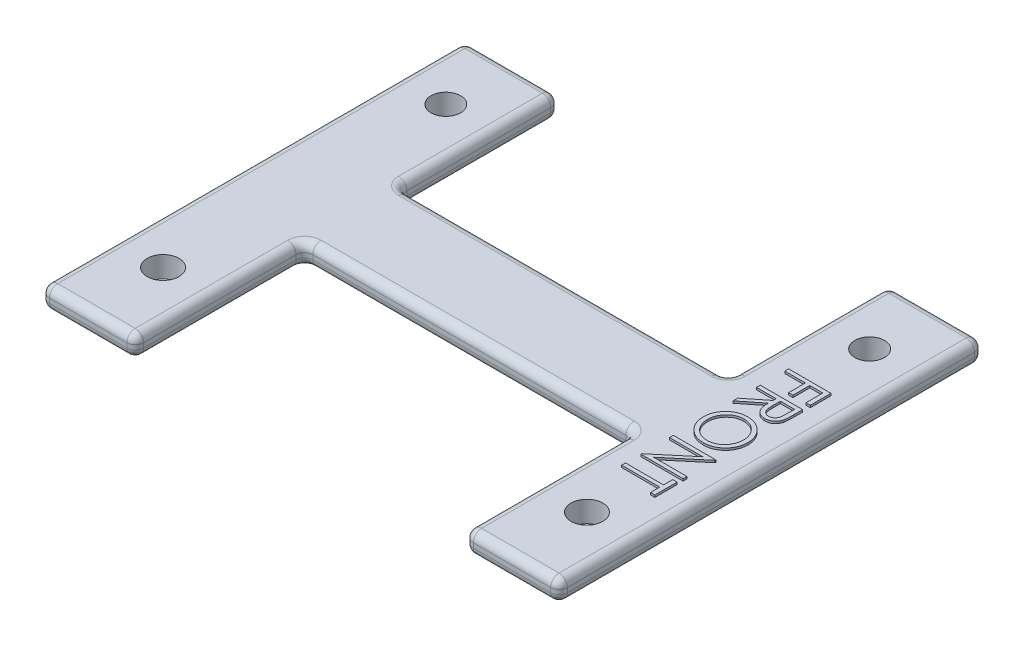
from build123d import *

# Parameters (mm, degrees)
BOSS_EXTRUDE4_DEPTH = 12.7
FILLET1_R           = 10
FILLET2_R           = 10
FILLET3_R           = 10
FILLET4_R           = 10
SKETCH2_R           = 17.78
SKETCH2_R_2         = 19.05
CUT_EXTRUDE1_DEPTH  = 45.72
BOSS_EXTRUDE5_DEPTH = 2.54


with BuildPart() as part:
    # Sketch1 → Boss-Extrude4 (new, symmetric)
    with BuildSketch(Plane(origin=(0, 0, 0), x_dir=(1, 0, 0), z_dir=(0, 1, 0))):
        Polygon((-310.388, 248.768026359), (-197.612, 248.768026359), (-197.612, 79.350026359), (-197.612, 56.388), (197.612, 56.388), (197.612, 79.350026359), (197.612, 248.768026359), (310.388, 248.768026359), (310.388, -259.231973641), (197.612, -259.231973641), (197.612, -89.813973641), (197.612, -56.388), (-197.612, -56.388), (-197.612, -89.813973641), (-197.612, -259.231973641), (-310.388, -259.231973641), align=None)
    extrude(amount=BOSS_EXTRUDE4_DEPTH, both=True)

    # Fillet1
    fillet1_edges = [part.edges().sort_by_distance(p)[0] for p in [
        (197.612, 12.7, 157.809986821),
        (0, 12.7, 56.388),
        (-197.612, 12.7, 157.809986821),
        (197.612, 0, 56.388),
        (-197.612, 0, 56.388),
        (-197.612, 0, 259.231973641),
        (-197.612, -12.7, 157.809986821),
        (0, -12.7, 56.388),
        (197.612, -12.7, 157.809986821),
    ]]
    fillet(fillet1_edges, radius=FILLET1_R)

    # Fillet2
    # the kernel refuses this fillet: 10 mm, written as the material it takes off along each edge
    with BuildSketch(Plane(origin=(-207.612, 2.7, 249.231973641), x_dir=(0, 0, 1), z_dir=(0, 1, 0))) as fillet2_piece_1_section:
        Polygon((0, 0), (FILLET2_R, 0), (FILLET2_R, FILLET2_R), (0, FILLET2_R), align=None)
    fillet2_piece_1 = extrude(amount=FILLET2_R, mode=Mode.PRIVATE)
    fillet2_piece_1 = fillet2_piece_1 - Plane(origin=(-207.612, 2.7, 249.231973641), x_dir=(-0.7071067811865475, 0, -0.7071067811865475), z_dir=(0, 1, 0)) * Sphere(FILLET2_R, mode=Mode.PRIVATE)
    add(fillet2_piece_1, mode=Mode.SUBTRACT)
    with BuildSketch(Plane(origin=(-207.612, -2.7, 249.231973641), x_dir=(0, -1, 0), z_dir=(0, 0, 1))) as fillet2_piece_2_section:
        Polygon((0, 0), (FILLET2_R, 0), (FILLET2_R, FILLET2_R), (0, FILLET2_R), align=None)
    fillet2_piece_2 = extrude(amount=FILLET2_R, mode=Mode.PRIVATE)
    fillet2_piece_2 = fillet2_piece_2 - Plane(origin=(-207.612, -2.7, 249.231973641), x_dir=(-0.7071067811865475, 0.7071067811865475, 0), z_dir=(0, 0, 1)) * Sphere(FILLET2_R, mode=Mode.PRIVATE)
    add(fillet2_piece_2, mode=Mode.SUBTRACT)
    with BuildSketch(Plane(origin=(-207.612, 12.7, 259.231973641), x_dir=(0, 0, -1), z_dir=(-1, 0, 0)), Plane(origin=(-207.612, -12.7, 259.231973641), x_dir=(0, 1, 0), z_dir=(-1, 0, 0))) as fillet2_piece_3:
        with BuildLine():
            CenterArc((FILLET2_R, FILLET2_R), FILLET2_R, 180, 90)
            Line((0, FILLET2_R), (0, 0))
            Line((0, 0), (FILLET2_R, 0))
        make_face()
    extrude(amount=127.776, mode=Mode.SUBTRACT)
    with BuildSketch(Plane(origin=(-310.388, -37.7, 259.231973641), x_dir=(1, 0, 0), z_dir=(0, 1, 0))) as fillet2_piece_4:
        with BuildLine():
            CenterArc((FILLET2_R, FILLET2_R), FILLET2_R, 180, 90)
            Line((0, FILLET2_R), (0, 0))
            Line((0, 0), (FILLET2_R, 0))
        make_face()
    extrude(amount=75.4, mode=Mode.SUBTRACT)

    # Fillet3
    fillet3_edges = [part.edges().sort_by_distance(p)[0] for p in [
        (310.388, 0, 259.231973641),
        (197.612, 0, 259.231973641),
        (259, 12.7, 259.231973641),
        (259, -12.7, 259.231973641),
        (200.540932188, 9.771067812, 259.231973641),
        (200.540932188, -9.771067812, 259.231973641),
    ]]
    fillet(fillet3_edges, radius=FILLET3_R)

    # Fillet4
    # the kernel refuses this fillet: 10 mm, written as the material it adds along each edge
    with BuildSketch(Plane(origin=(-197.612, 12.7, -56.388), x_dir=(1, 0, 0), z_dir=(0, -1, 0)), Plane(origin=(197.612, 12.7, -56.388), x_dir=(0, 0, -1), z_dir=(0, -1, 0))) as fillet4_piece_1:
        with BuildLine():
            CenterArc((FILLET4_R, -FILLET4_R), FILLET4_R, 90, 90)
            Line((0, -FILLET4_R), (0, 0))
            Line((0, 0), (FILLET4_R, 0))
        make_face()
    extrude(amount=25.4)
    # the kernel refuses this fillet: 10 mm, written as the material it takes off along each edge
    with BuildSketch(Plane(origin=(300.388, -2.7, 249.231973641), x_dir=(0, -1, 0), z_dir=(1, 0, 0))) as fillet4_2_piece_1_section:
        Polygon((0, 0), (FILLET4_R * 1.02, 0), (FILLET4_R * 1.02, -FILLET4_R * 1.02), (0, -FILLET4_R * 1.02), align=None)
    fillet4_2_piece_1 = extrude(amount=FILLET4_R * 1.02, mode=Mode.PRIVATE)
    fillet4_2_piece_1 = fillet4_2_piece_1 - Plane(origin=(300.388, -2.7, 249.231973641), x_dir=(0, 0.7071067811865475, -0.7071067811865475), z_dir=(1, 0, 0)) * Sphere(FILLET4_R, mode=Mode.PRIVATE)
    add(fillet4_2_piece_1, mode=Mode.SUBTRACT)
    with BuildSketch(Plane(origin=(300.388, 2.7, 249.231973641), x_dir=(1, 0, 0), z_dir=(0, 1, 0))) as fillet4_2_piece_2_section:
        Polygon((0, 0), (FILLET4_R * 1.02, 0), (FILLET4_R * 1.02, -FILLET4_R * 1.02), (0, -FILLET4_R * 1.02), align=None)
    fillet4_2_piece_2 = extrude(amount=FILLET4_R * 1.02, mode=Mode.PRIVATE)
    fillet4_2_piece_2 = fillet4_2_piece_2 - Plane(origin=(300.388, 2.7, 249.231973641), x_dir=(-0.7071067811865475, 0, -0.7071067811865475), z_dir=(0, 1, 0)) * Sphere(FILLET4_R, mode=Mode.PRIVATE)
    add(fillet4_2_piece_2, mode=Mode.SUBTRACT)
    with BuildSketch(Plane(origin=(-300.388, 2.7, 249.231973641), x_dir=(-1, 0, 0), z_dir=(0, 1, 0))) as fillet4_2_piece_3_section:
        Polygon((0, 0), (FILLET4_R * 1.02, 0), (FILLET4_R * 1.02, FILLET4_R * 1.02), (0, FILLET4_R * 1.02), align=None)
    fillet4_2_piece_3 = extrude(amount=FILLET4_R * 1.02, mode=Mode.PRIVATE)
    fillet4_2_piece_3 = fillet4_2_piece_3 - Plane(origin=(-300.388, 2.7, 249.231973641), x_dir=(0.7071067811865475, 0, -0.7071067811865475), z_dir=(0, 1, 0)) * Sphere(FILLET4_R, mode=Mode.PRIVATE)
    add(fillet4_2_piece_3, mode=Mode.SUBTRACT)
    with BuildSketch(Plane(origin=(-300.388, -2.7, 249.231973641), x_dir=(0, -1, 0), z_dir=(-1, 0, 0))) as fillet4_2_piece_4_section:
        Polygon((0, 0), (FILLET4_R * 1.02, 0), (FILLET4_R * 1.02, FILLET4_R * 1.02), (0, FILLET4_R * 1.02), align=None)
    fillet4_2_piece_4 = extrude(amount=FILLET4_R * 1.02, mode=Mode.PRIVATE)
    fillet4_2_piece_4 = fillet4_2_piece_4 - Plane(origin=(-300.388, -2.7, 249.231973641), x_dir=(0, 0.7071067811865475, -0.7071067811865475), z_dir=(-1, 0, 0)) * Sphere(FILLET4_R, mode=Mode.PRIVATE)
    add(fillet4_2_piece_4, mode=Mode.SUBTRACT)
    with BuildSketch(Plane(origin=(300.388, -2.7, -238.768026359), x_dir=(0, 0, -1), z_dir=(1, 0, 0))) as fillet4_2_piece_5_section:
        Polygon((0, 0), (FILLET4_R * 1.02, 0), (FILLET4_R * 1.02, -FILLET4_R * 1.02), (0, -FILLET4_R * 1.02), align=None)
    fillet4_2_piece_5 = extrude(amount=FILLET4_R * 1.02, mode=Mode.PRIVATE)
    fillet4_2_piece_5 = fillet4_2_piece_5 - Plane(origin=(300.388, -2.7, -238.768026359), x_dir=(0, 0.7071067811865475, 0.7071067811865475), z_dir=(1, 0, 0)) * Sphere(FILLET4_R, mode=Mode.PRIVATE)
    add(fillet4_2_piece_5, mode=Mode.SUBTRACT)
    with BuildSketch(Plane(origin=(-300.388, 2.7, -238.768026359), x_dir=(0, 0, -1), z_dir=(0, 1, 0))) as fillet4_2_piece_6_section:
        Polygon((0, 0), (FILLET4_R * 1.02, 0), (FILLET4_R * 1.02, FILLET4_R * 1.02), (0, FILLET4_R * 1.02), align=None)
    fillet4_2_piece_6 = extrude(amount=FILLET4_R * 1.02, mode=Mode.PRIVATE)
    fillet4_2_piece_6 = fillet4_2_piece_6 - Plane(origin=(-300.388, 2.7, -238.768026359), x_dir=(0.7071067811865475, 0, 0.7071067811865475), z_dir=(0, 1, 0)) * Sphere(FILLET4_R, mode=Mode.PRIVATE)
    add(fillet4_2_piece_6, mode=Mode.SUBTRACT)
    with BuildSketch(Plane(origin=(300.388, 2.7, -238.768026359), x_dir=(1, 0, 0), z_dir=(0, 1, 0))) as fillet4_2_piece_7_section:
        Polygon((0, 0), (FILLET4_R * 1.02, 0), (FILLET4_R * 1.02, FILLET4_R * 1.02), (0, FILLET4_R * 1.02), align=None)
    fillet4_2_piece_7 = extrude(amount=FILLET4_R * 1.02, mode=Mode.PRIVATE)
    fillet4_2_piece_7 = fillet4_2_piece_7 - Plane(origin=(300.388, 2.7, -238.768026359), x_dir=(-0.7071067811865475, 0, 0.7071067811865475), z_dir=(0, 1, 0)) * Sphere(FILLET4_R, mode=Mode.PRIVATE)
    add(fillet4_2_piece_7, mode=Mode.SUBTRACT)
    with BuildSketch(Plane(origin=(-300.388, -2.7, -238.768026359), x_dir=(-1, 0, 0), z_dir=(0, 0, -1))) as fillet4_2_piece_8_section:
        Polygon((0, 0), (FILLET4_R * 1.02, 0), (FILLET4_R * 1.02, -FILLET4_R * 1.02), (0, -FILLET4_R * 1.02), align=None)
    fillet4_2_piece_8 = extrude(amount=FILLET4_R * 1.02, mode=Mode.PRIVATE)
    fillet4_2_piece_8 = fillet4_2_piece_8 - Plane(origin=(-300.388, -2.7, -238.768026359), x_dir=(0.7071067811865475, 0.7071067811865475, 0), z_dir=(0, 0, -1)) * Sphere(FILLET4_R, mode=Mode.PRIVATE)
    add(fillet4_2_piece_8, mode=Mode.SUBTRACT)
    with BuildSketch(Plane(origin=(310.388, -12.7, -238.768026359), x_dir=(0, 1, 0), z_dir=(0, 0, 1)), Plane(origin=(-310.388, 12.7, 249.231973641), x_dir=(1, 0, 0), z_dir=(0, 0, -1)), Plane(origin=(-310.388, -12.7, 249.231973641), x_dir=(0, 1, 0), z_dir=(0, 0, -1)), Plane(origin=(310.388, 12.7, -238.768026359), x_dir=(-1, 0, 0), z_dir=(0, 0, 1))) as fillet4_2_piece_9:
        with BuildLine():
            CenterArc((FILLET4_R, FILLET4_R), FILLET4_R, 180, 90)
            Line((0, FILLET4_R), (0, 0))
            Line((0, 0), (FILLET4_R, 0))
        make_face()
    extrude(amount=488, mode=Mode.SUBTRACT)
    with BuildSketch(Plane(origin=(-300.388, 12.7, -248.768026359), x_dir=(0, 0, 1), z_dir=(1, 0, 0)), Plane(origin=(172.612, 12.7, -248.768026359), x_dir=(0, 0, 1), z_dir=(1, 0, 0)), Plane(origin=(-300.388, -12.7, -248.768026359), x_dir=(0, 1, 0), z_dir=(1, 0, 0)), Plane(origin=(172.612, -12.7, -248.768026359), x_dir=(0, 1, 0), z_dir=(1, 0, 0))) as fillet4_2_piece_10:
        with BuildLine():
            CenterArc((FILLET4_R, FILLET4_R), FILLET4_R, 180, 90)
            Line((0, FILLET4_R), (0, 0))
            Line((0, 0), (FILLET4_R, 0))
        make_face()
    extrude(amount=127.776, mode=Mode.SUBTRACT)
    with BuildSketch(Plane(origin=(-310.388, -2.7, -248.768026359), x_dir=(1, 0, 0), z_dir=(0, 1, 0))) as fillet4_2_piece_11:
        with BuildLine():
            CenterArc((FILLET4_R, -FILLET4_R), FILLET4_R, 90, 90)
            Line((0, -FILLET4_R), (0, 0))
            Line((0, 0), (FILLET4_R, 0))
        make_face()
    extrude(amount=5.4, mode=Mode.SUBTRACT)
    with BuildSketch(Plane(origin=(-197.612, 37.7, -248.768026359), x_dir=(0, 0, 1), z_dir=(0, -1, 0)), Plane(origin=(197.612, 37.7, -248.768026359), x_dir=(1, 0, 0), z_dir=(0, -1, 0))) as fillet4_2_piece_12:
        with BuildLine():
            CenterArc((FILLET4_R, FILLET4_R), FILLET4_R, 180, 90)
            Line((0, FILLET4_R), (0, 0))
            Line((0, 0), (FILLET4_R, 0))
        make_face()
    extrude(amount=75.4, mode=Mode.SUBTRACT)
    with BuildSketch(Plane(origin=(310.388, 2.7, -248.768026359), x_dir=(0, 0, 1), z_dir=(0, -1, 0))) as fillet4_2_piece_13:
        with BuildLine():
            CenterArc((FILLET4_R, FILLET4_R), FILLET4_R, 180, 90)
            Line((0, FILLET4_R), (0, 0))
            Line((0, 0), (FILLET4_R, 0))
        make_face()
    extrude(amount=5.4, mode=Mode.SUBTRACT)
    # the kernel refuses this fillet: 10 mm, written as the material it takes off along each edge
    with BuildSketch(Plane(origin=(-207.612, -2.7, -238.768026359), x_dir=(0, -1, 0), z_dir=(1, 0, 0))) as fillet4_3_piece_1_section:
        Polygon((0, 0), (FILLET4_R * 1.02, 0), (FILLET4_R * 1.02, FILLET4_R * 1.02), (0, FILLET4_R * 1.02), align=None)
    fillet4_3_piece_1 = extrude(amount=FILLET4_R * 1.02, mode=Mode.PRIVATE)
    fillet4_3_piece_1 = fillet4_3_piece_1 - Plane(origin=(-207.612, -2.7, -238.768026359), x_dir=(0, 0.7071067811865475, 0.7071067811865475), z_dir=(1, 0, 0)) * Sphere(FILLET4_R, mode=Mode.PRIVATE)
    add(fillet4_3_piece_1, mode=Mode.SUBTRACT)
    with BuildSketch(Plane(origin=(207.612, 2.7, -238.768026359), x_dir=(-1, 0, 0), z_dir=(0, 1, 0))) as fillet4_3_piece_2_section:
        Polygon((0, 0), (FILLET4_R * 1.02, 0), (FILLET4_R * 1.02, -FILLET4_R * 1.02), (0, -FILLET4_R * 1.02), align=None)
    fillet4_3_piece_2 = extrude(amount=FILLET4_R * 1.02, mode=Mode.PRIVATE)
    fillet4_3_piece_2 = fillet4_3_piece_2 - Plane(origin=(207.612, 2.7, -238.768026359), x_dir=(0.7071067811865475, 0, 0.7071067811865475), z_dir=(0, 1, 0)) * Sphere(FILLET4_R, mode=Mode.PRIVATE)
    add(fillet4_3_piece_2, mode=Mode.SUBTRACT)
    with BuildSketch(Plane(origin=(-207.612, 2.7, -238.768026359), x_dir=(1, 0, 0), z_dir=(0, 1, 0))) as fillet4_3_piece_3_section:
        Polygon((0, 0), (FILLET4_R * 1.02, 0), (FILLET4_R * 1.02, FILLET4_R * 1.02), (0, FILLET4_R * 1.02), align=None)
    fillet4_3_piece_3 = extrude(amount=FILLET4_R * 1.02, mode=Mode.PRIVATE)
    fillet4_3_piece_3 = fillet4_3_piece_3 - Plane(origin=(-207.612, 2.7, -238.768026359), x_dir=(-0.7071067811865475, 0, 0.7071067811865475), z_dir=(0, 1, 0)) * Sphere(FILLET4_R, mode=Mode.PRIVATE)
    add(fillet4_3_piece_3, mode=Mode.SUBTRACT)
    with BuildSketch(Plane(origin=(207.612, -2.7, -238.768026359), x_dir=(0, -1, 0), z_dir=(-1, 0, 0))) as fillet4_3_piece_4_section:
        Polygon((0, 0), (FILLET4_R * 1.02, 0), (FILLET4_R * 1.02, -FILLET4_R * 1.02), (0, -FILLET4_R * 1.02), align=None)
    fillet4_3_piece_4 = extrude(amount=FILLET4_R * 1.02, mode=Mode.PRIVATE)
    fillet4_3_piece_4 = fillet4_3_piece_4 - Plane(origin=(207.612, -2.7, -238.768026359), x_dir=(0, 0.7071067811865475, 0.7071067811865475), z_dir=(-1, 0, 0)) * Sphere(FILLET4_R, mode=Mode.PRIVATE)
    add(fillet4_3_piece_4, mode=Mode.SUBTRACT)
    with BuildSketch(Plane(origin=(197.612, -12.7, -66.388), x_dir=(0, 1, 0), z_dir=(0, 0, -1)), Plane(origin=(-197.612, 12.7, -238.768026359), x_dir=(-1, 0, 0), z_dir=(0, 0, 1))) as fillet4_3_piece_5:
        with BuildLine():
            CenterArc((FILLET4_R, FILLET4_R), FILLET4_R, 180, 90)
            Line((0, FILLET4_R), (0, 0))
            Line((0, 0), (FILLET4_R, 0))
        make_face()
    extrude(amount=172.380026359, mode=Mode.SUBTRACT)
    with BuildSketch(Plane(origin=(-187.612, 12.7, -56.388), x_dir=(0, 0, 1), z_dir=(1, 0, 0)), Plane(origin=(-187.612, -12.7, -56.388), x_dir=(0, 1, 0), z_dir=(1, 0, 0))) as fillet4_3_piece_6:
        with BuildLine():
            CenterArc((FILLET4_R, FILLET4_R), FILLET4_R, 180, 90)
            Line((0, FILLET4_R), (0, 0))
            Line((0, 0), (FILLET4_R, 0))
        make_face()
    extrude(amount=375.224, mode=Mode.SUBTRACT)
    with BuildSketch(Plane(origin=(197.612, 12.7, -238.768026359), x_dir=(1, 0, 0), z_dir=(0, 0, 1)), Plane(origin=(-197.612, -12.7, -66.388), x_dir=(0, 1, 0), z_dir=(0, 0, -1))) as fillet4_3_piece_7:
        with BuildLine():
            CenterArc((FILLET4_R, -FILLET4_R), FILLET4_R, 90, 90)
            Line((0, -FILLET4_R), (0, 0))
            Line((0, 0), (FILLET4_R, 0))
        make_face()
    extrude(amount=172.380026359, mode=Mode.SUBTRACT)
    with BuildSketch(Plane(origin=(-187.612, -12.7, -66.388), x_dir=(0, 0, 1), z_dir=(1, 0, 0))) as fillet4_3_piece_8:
        with BuildLine():
            CenterArc((10 + FILLET4_R, -FILLET4_R), FILLET4_R, 90, 90)
            Line((10 + FILLET4_R, 0), (10, 0))
            Line((10, 0), (10, -FILLET4_R))
        make_face()
    revolve(axis=Axis((-187.612, -12.7, -66.388), (0, -1, 0)), revolution_arc=90, mode=Mode.SUBTRACT)
    with BuildSketch(Plane(origin=(187.612, -12.7, -66.388), x_dir=(1, 0, 0), z_dir=(0, 0, -1))) as fillet4_3_piece_9:
        with BuildLine():
            CenterArc((10 + FILLET4_R, -FILLET4_R), FILLET4_R, 90, 90)
            Line((10 + FILLET4_R, 0), (10, 0))
            Line((10, 0), (10, -FILLET4_R))
        make_face()
    revolve(axis=Axis((187.612, -12.7, -66.388), (0, -1, 0)), revolution_arc=90, mode=Mode.SUBTRACT)
    with BuildSketch(Plane(origin=(187.612, 12.7, -66.388), x_dir=(1, 0, 0), z_dir=(0, 0, -1))) as fillet4_3_piece_10:
        with BuildLine():
            CenterArc((10 + FILLET4_R, FILLET4_R), FILLET4_R, 180, 90)
            Line((10, FILLET4_R), (10, 0))
            Line((10, 0), (10 + FILLET4_R, 0))
        make_face()
    revolve(axis=Axis((187.612, 12.7, -66.388), (0, -1, 0)), revolution_arc=90, mode=Mode.SUBTRACT)
    with BuildSketch(Plane(origin=(-187.612, 12.7, -66.388), x_dir=(0, 0, 1), z_dir=(1, 0, 0))) as fillet4_3_piece_11:
        with BuildLine():
            CenterArc((10 + FILLET4_R, FILLET4_R), FILLET4_R, 180, 90)
            Line((10, FILLET4_R), (10, 0))
            Line((10, 0), (10 + FILLET4_R, 0))
        make_face()
    revolve(axis=Axis((-187.612, 12.7, -66.388), (0, -1, 0)), revolution_arc=90, mode=Mode.SUBTRACT)

    # Sketch2 → Cut-Extrude1 (cut, symmetric)
    with BuildSketch(Plane(origin=(0, 0, 0), x_dir=(1, 0, 0), z_dir=(0, 1, 0))):
        with Locations(Location((-254, 169.418, 0), (0, 0, 90))):
            Circle(SKETCH2_R)
        with Locations(Location((-254, -169.418, 0), (0, 0, 90))):
            Circle(SKETCH2_R_2)
        with Locations(Location((254, -169.418, 0), (0, 0, 90))):
            Circle(SKETCH2_R_2)
        with Locations(Location((254, 169.418, 0), (0, 0, 90))):
            Circle(SKETCH2_R)
    extrude(amount=CUT_EXTRUDE1_DEPTH, both=True, mode=Mode.SUBTRACT)

    # Sketch3 → Boss-Extrude5 (add)
    # profile 1 of 5: a face of its own
    with BuildSketch(Plane(origin=(0, 12.7, 0), x_dir=(1, 0, 0), z_dir=(0, 1, 0))):
        Polygon((279.367, 97.670590462), (279.367, 72.921872513), (274.15674359, 72.921872513), (274.15674359, 93.111616103), (258.525974359, 93.111616103), (258.525974359, 72.921872513), (253.315717949, 72.921872513), (253.315717949, 93.111616103), (228.567, 93.111616103), (228.567, 97.670590462), align=None)
    # profile 2 of 5: a face of its own
    with BuildSketch(Plane(origin=(0, 12.7, 0), x_dir=(1, 0, 0), z_dir=(0, 1, 0))):
        with BuildLine():
            Line((279.367, 63.803923795), (279.367, 53.637818026))
            add(Edge.make_bspline(
                [(279.367, 53.637818026), (279.364741781, 52.959403932), (279.360405749, 51.656773721), (279.33622839, 49.79062454), (279.266932027, 48.094962675), (279.207298873, 46.570674722), (279.098558696, 45.217788644), (278.994627018, 44.032155967), (278.858575027, 43.019237386), (278.732222031, 42.40606903), (278.675012821, 42.128443026)],
                knots=[0, 0, 0, 0, 1.410062039, 2.707475311, 3.878576406, 4.937260626, 5.877586885, 6.699081471, 7.410979367, 8, 8, 8, 8], degree=3))
            add(Edge.make_bspline(
                [(278.675012821, 42.128443026), (278.583194758, 41.75677462), (278.401517361, 41.021366505), (278.017324022, 39.962643379), (277.57345962, 38.953342225), (277.04807792, 37.997250654), (276.450342711, 37.094279973), (275.776761643, 36.245782175), (275.023904425, 35.456608363), (274.210995861, 34.72068623), (273.330943078, 34.0535965), (272.396566063, 33.476317621), (271.413708795, 32.981996614), (270.378948602, 32.587365289), (269.301032681, 32.269896487), (268.170548794, 32.045975139), (266.992550689, 31.911706427), (266.189070809, 31.898035284), (265.781663462, 31.891103282)],
                knots=[0, 0, 0, 0, 1.02737288, 2.032829108, 3.019628684, 3.985738875, 4.958353778, 5.924249254, 6.890702889, 7.883913451, 8.865824512, 9.85161466, 10.829249435, 11.81541824, 12.821369441, 13.843154991, 14.906364023, 16, 16, 16, 16], degree=3))
            add(Edge.make_bspline(
                [(265.781663462, 31.891103282), (265.10478745, 31.912424187), (263.784027036, 31.954026795), (261.867268552, 32.341930314), (260.079223857, 32.977286965), (258.422381289, 33.852940548), (256.92816431, 34.967534986), (255.620183735, 36.307024047), (254.515534545, 37.864567052), (253.75764784, 39.321344931), (253.26999105, 40.608796675), (252.925151473, 41.671818169), (252.663212496, 42.83227543), (252.425146566, 44.073519935), (252.243483135, 45.40513918), (252.114467573, 46.824451612), (252.031509585, 48.335007013), (252.019389068, 49.370452697), (252.013153846, 49.903122513)],
                knots=[0, 0, 0, 0, 1.260402266, 2.459371274, 3.627181936, 4.786749125, 5.93865593, 7.087644312, 8.261344208, 9.485713728, 10.136162886, 10.825977872, 11.566646758, 12.35154167, 13.181268117, 14.0701832, 15.007234106, 16, 16, 16, 16], degree=3))
            Line((252.013153846, 49.903122513), (228.567, 31.239821231))
            Line((228.567, 31.239821231), (228.567, 36.877481487))
            Line((228.567, 36.877481487), (252.013153846, 55.540782769))
            Line((252.013153846, 55.540782769), (252.013153846, 59.244949436))
            Line((252.013153846, 59.244949436), (228.567, 59.244949436))
            Line((228.567, 59.244949436), (228.567, 63.803923795))
            Line((228.567, 63.803923795), (279.367, 63.803923795))
        make_face()
        with BuildLine():
            Line((274.15674359, 59.244949436), (257.223410256, 59.244949436))
            Line((257.223410256, 59.244949436), (257.152176282, 49.943827641))
            add(Edge.make_bspline(
                [(257.152176282, 49.943827641), (257.151984163, 49.509559649), (257.151611781, 48.667824595), (257.209578572, 47.45006635), (257.275521655, 46.316208812), (257.376386228, 45.270588475), (257.506377913, 44.312739779), (257.668978941, 43.443136407), (257.858427758, 42.660375402), (258.151608535, 41.747407216), (258.616365238, 40.728250132), (259.291397868, 39.619270992), (260.145935513, 38.678089619), (261.107555788, 37.866608855), (262.186582431, 37.24156199), (263.335121516, 36.786637534), (264.543257327, 36.501147089), (265.373065804, 36.467206309), (265.791839744, 36.450077641)],
                knots=[0, 0, 0, 0, 1.14660753, 2.222451964, 3.218720504, 4.145691244, 4.995719623, 5.770487122, 6.480909919, 7.121111896, 8.299844659, 9.430703709, 10.534634535, 11.641396424, 12.741395289, 13.810956493, 14.895269934, 16, 16, 16, 16], degree=3))
            add(Edge.make_bspline(
                [(265.791839744, 36.450077641), (266.200480447, 36.467258961), (267.010257212, 36.501306067), (268.19249566, 36.787190683), (269.31629125, 37.248852539), (270.360223687, 37.896209305), (271.315728027, 38.678440668), (272.121980881, 39.607456726), (272.797170654, 40.636471091), (273.225489309, 41.598916603), (273.488612258, 42.458570983), (273.673541155, 43.205071271), (273.823369929, 44.05175879), (273.939858969, 44.996604416), (274.044685795, 46.037898765), (274.112652731, 47.178493104), (274.153731959, 48.417070296), (274.15571635, 49.275549398), (274.15674359, 49.719949436)],
                knots=[0, 0, 0, 0, 1.100801541, 2.181386982, 3.260112282, 4.364594493, 5.481957178, 6.577424609, 7.668452592, 8.790448866, 9.403819393, 10.091598921, 10.863153553, 11.720938239, 12.658472417, 13.685008818, 14.801622349, 16, 16, 16, 16], degree=3))
            Line((274.15674359, 49.719949436), (274.15674359, 59.244949436))
        make_face(mode=Mode.SUBTRACT)
    # profile 3 of 5: a face of its own
    with BuildSketch(Plane(origin=(0, 12.7, 0), x_dir=(1, 0, 0), z_dir=(0, 1, 0))):
        with BuildLine():
            add(Edge.make_bspline(
                [(280.669564103, -2.952486462), (280.645738985, -3.893129638), (280.598944488, -5.740630444), (280.240748013, -8.455891649), (279.621043621, -11.048062037), (278.79575928, -13.538315991), (277.694634763, -15.896652733), (276.364461202, -18.141623406), (274.786320394, -20.266880622), (272.986692815, -22.252943837), (271.021487083, -24.063708092), (268.918212488, -25.645760348), (266.705670094, -26.983373578), (264.376160837, -28.079721354), (261.939937715, -28.940594301), (259.38314881, -29.534451551), (256.722593897, -29.913842732), (254.907916779, -29.958193149), (253.987352564, -29.98069159)],
                knots=[0, 0, 0, 0, 1.06508495, 2.091914715, 3.094501328, 4.079693967, 5.057647778, 6.035986298, 7.030177474, 8.050107388, 9.066943579, 10.051896531, 11.025616101, 11.9896488, 12.96281505, 13.945825876, 14.957941789, 16, 16, 16, 16], degree=3))
            add(Edge.make_bspline(
                [(253.987352564, -29.98069159), (253.073569412, -29.958196484), (251.272396956, -29.913856024), (248.628726265, -29.534019749), (246.087368389, -28.93839461), (243.652812558, -28.087707034), (241.321575154, -26.996626119), (239.104965879, -25.649972573), (236.987128001, -24.078394525), (235.01238209, -22.273889016), (233.198060612, -20.309151934), (231.613548688, -18.199946258), (230.259466258, -15.989581332), (229.170638241, -13.661480309), (228.303672674, -11.241597653), (227.712019432, -8.707755232), (227.330524807, -6.071259281), (227.286707271, -4.273363721), (227.264435897, -3.359537744)],
                knots=[0, 0, 0, 0, 1.04355943, 2.056976533, 3.044937463, 4.02179873, 4.997890911, 5.980248884, 6.980147982, 8.006253959, 9.032111064, 10.031228745, 11.015595249, 11.988180414, 12.962670953, 13.946861971, 14.95644057, 16, 16, 16, 16], degree=3))
            add(Edge.make_bspline(
                [(227.264435897, -3.359537744), (227.286921123, -2.438977257), (227.331245488, -0.624307489), (227.711293152, 2.039575672), (228.305368244, 4.59821586), (229.155171427, 7.043735059), (230.249307681, 9.376935788), (231.593838653, 11.59759239), (233.178183743, 13.708373335), (234.980286783, 15.68779898), (236.945968098, 17.496726436), (239.041309867, 19.087782588), (241.246384189, 20.424562054), (243.55210133, 21.519160193), (245.95250141, 22.384945643), (248.462683843, 22.975801718), (251.068582699, 23.358034408), (252.842849518, 23.402085076), (253.743121795, 23.424436615)],
                knots=[0, 0, 0, 0, 1.053167129, 2.076072758, 3.073341244, 4.055601477, 5.033424535, 6.017524495, 7.021518915, 8.049444456, 9.077120685, 10.074910483, 11.055688766, 12.022980584, 12.991883888, 13.970269434, 14.970104079, 16, 16, 16, 16], degree=3))
            add(Edge.make_bspline(
                [(253.743121795, 23.424436615), (254.347393012, 23.416683878), (255.548312293, 23.401276209), (257.331592597, 23.215509235), (259.086386439, 22.946491782), (260.80679505, 22.558930887), (262.49309937, 22.059010209), (264.141850812, 21.442942783), (265.766630243, 20.736929274), (267.336515229, 19.89632267), (268.853969816, 18.979195707), (270.300019496, 17.9791609), (271.648833919, 16.889245543), (272.922086367, 15.72501882), (274.098045318, 14.470365222), (275.202349385, 13.14416725), (276.223567221, 11.739485632), (277.140250437, 10.254098831), (277.982235107, 8.725877345), (278.685223018, 7.143733854), (279.306570056, 5.541049993), (279.800356696, 3.903708698), (280.193315047, 2.235497405), (280.460320316, 0.534330672), (280.64650006, -1.198039325), (280.661843011, -2.365154587), (280.669564103, -2.952486462)],
                knots=[0, 0, 0, 0, 1.037115869, 2.061148057, 3.07517727, 4.084041727, 5.086514338, 6.092668487, 7.104487461, 8.125783165, 9.147610153, 10.147694368, 11.141876323, 12.122903372, 13.107606018, 14.091946891, 15.084523921, 16.086505767, 17.087268121, 18.077809654, 19.05670789, 20.036870126, 21.011670792, 21.99694167, 22.991993299, 24, 24, 24, 24], degree=3))
        make_face()
        with BuildLine():
            add(Edge.make_bspline(
                [(275.459307692, -3.176364667), (275.453433797, -2.694276885), (275.441742161, -1.734710114), (275.287621269, -0.308196543), (275.068177482, 1.099633354), (274.754356046, 2.488702975), (274.330708491, 3.851537201), (273.83153022, 5.201745777), (273.24432263, 6.532845477), (272.559623959, 7.829955557), (271.81166502, 9.090907893), (270.990754163, 10.288917527), (270.100871934, 11.412033498), (269.153773089, 12.463853554), (268.139821262, 13.441312709), (267.075199201, 14.364224723), (265.92925915, 15.195444922), (264.73313359, 15.957237435), (263.488364793, 16.638941592), (262.208061838, 17.245136016), (260.881779933, 17.741002165), (259.523908174, 18.145404665), (258.136597042, 18.480681917), (256.709322437, 18.693082873), (255.249256239, 18.848855404), (254.262548186, 18.859884018), (253.763474359, 18.865462256)],
                knots=[0, 0, 0, 0, 1.008585988, 2.007529826, 2.999688727, 3.990042337, 4.984966365, 5.984641633, 7.001812546, 8.027570247, 9.052811818, 10.068991095, 11.064725446, 12.050001529, 13.029093193, 14.010961114, 14.996492974, 15.989185205, 16.977398719, 17.96520407, 18.951579521, 19.937648295, 20.929603947, 21.935788061, 22.955928099, 24, 24, 24, 24], degree=3))
            add(Edge.make_bspline(
                [(253.763474359, 18.865462256), (253.02959984, 18.846958546), (251.585841629, 18.810556022), (249.470121141, 18.491857576), (247.436839728, 18.000955776), (245.497122873, 17.277311714), (243.634297282, 16.372337079), (241.86488822, 15.254346785), (240.188417472, 13.929786343), (238.616588996, 12.4251843), (237.181912752, 10.780386159), (235.922603849, 9.033842536), (234.857106509, 7.204264461), (233.989078601, 5.286880833), (233.301250407, 3.291927981), (232.829846275, 1.206550955), (232.519596809, -0.955358573), (232.489802523, -2.429003511), (232.474692308, -3.176364667)],
                knots=[0, 0, 0, 0, 1.032063989, 2.030389145, 3.003944642, 3.970395727, 4.937377036, 5.913328081, 6.909231446, 7.93887556, 8.970685674, 9.976071282, 10.964166581, 11.944589148, 12.933237628, 13.927779006, 14.949070134, 16, 16, 16, 16], degree=3))
            add(Edge.make_bspline(
                [(232.474692308, -3.176364667), (232.481593894, -3.678696876), (232.495281811, -4.674972518), (232.633148619, -6.156815889), (232.854227204, -7.61196398), (233.17253914, -9.038371073), (233.570900445, -10.434435674), (234.044235265, -11.805920154), (234.634479459, -13.138457738), (235.287675696, -14.447945326), (236.026967558, -15.701613488), (236.836403724, -16.891039945), (237.710371386, -18.009329106), (238.649245763, -19.058903117), (239.644933503, -20.043134971), (240.723035381, -20.935298645), (241.852065866, -21.776476727), (243.050981391, -22.535218938), (244.298373271, -23.21556775), (245.58352585, -23.807173229), (246.902022499, -24.309384051), (248.256097898, -24.714726709), (249.643091343, -25.032383857), (251.064883968, -25.251256683), (252.518624987, -25.404360125), (253.501878708, -25.415900049), (253.997528846, -25.421717231)],
                knots=[0, 0, 0, 0, 1.047226202, 2.076964084, 3.100341814, 4.114585567, 5.122123135, 6.126552355, 7.137064942, 8.158803602, 9.176592812, 10.169297945, 11.156925011, 12.133779169, 13.104132798, 14.073170763, 15.049307625, 16.038276215, 17.028988595, 18.010110019, 18.986169996, 19.968539974, 20.955178716, 21.950601663, 22.966915103, 24, 24, 24, 24], degree=3))
            add(Edge.make_bspline(
                [(253.997528846, -25.421717231), (254.489788165, -25.415895362), (255.466275202, -25.404346614), (256.909877937, -25.251330125), (258.321438835, -25.032151488), (259.695416319, -24.716281325), (261.032160625, -24.30915338), (262.330416278, -23.807142984), (263.595019795, -23.215173495), (264.822845591, -22.535785552), (266.001038933, -21.772104458), (267.127382511, -20.937616581), (268.18072405, -20.017913824), (269.187067471, -19.039273195), (270.124950509, -17.97725021), (270.994681087, -16.836654738), (271.817260834, -15.631337262), (272.559282537, -14.355127857), (273.244673131, -13.03807559), (273.83138642, -11.686477341), (274.33286736, -10.31327679), (274.752621974, -8.925504661), (275.068484941, -7.513384654), (275.287542536, -6.085140146), (275.441758663, -4.638329895), (275.453439453, -3.665232846), (275.459307692, -3.176364667)],
                knots=[0, 0, 0, 0, 1.029967493, 2.04313025, 3.035375922, 4.01889446, 4.991458755, 5.958017022, 6.930036849, 7.912118993, 8.892942568, 9.867138445, 10.843712051, 11.817804417, 12.803729339, 13.806387533, 14.818654169, 15.856205545, 16.894655496, 17.924916651, 18.938004761, 19.953404357, 20.957695443, 21.963967554, 22.97713031, 24, 24, 24, 24], degree=3))
        make_face(mode=Mode.SUBTRACT)
    # profile 4 of 5: a face of its own
    with BuildSketch(Plane(origin=(0, 12.7, 0), x_dir=(1, 0, 0), z_dir=(0, 1, 0))):
        Polygon((228.567, -40.40120441), (279.367, -40.40120441), (279.367, -41.357774923), (239.384387821, -74.919153128), (279.367, -74.919153128), (279.367, -79.478127487), (228.567, -79.478127487), (228.567, -78.440146718), (268.458025641, -44.960178769), (228.567, -44.960178769), align=None)
    # profile 5 of 5: a face of its own
    with BuildSketch(Plane(origin=(0, 12.7, 0), x_dir=(1, 0, 0), z_dir=(0, 1, 0))):
        Polygon((274.15674359, -86.642230051), (279.367, -86.642230051), (279.367, -113.344794154), (274.15674359, -113.344794154), (274.15674359, -102.272999282), (228.567, -102.272999282), (228.567, -97.714024923), (274.15674359, -97.714024923), align=None)
    extrude(amount=BOSS_EXTRUDE5_DEPTH)


solid = part.part
